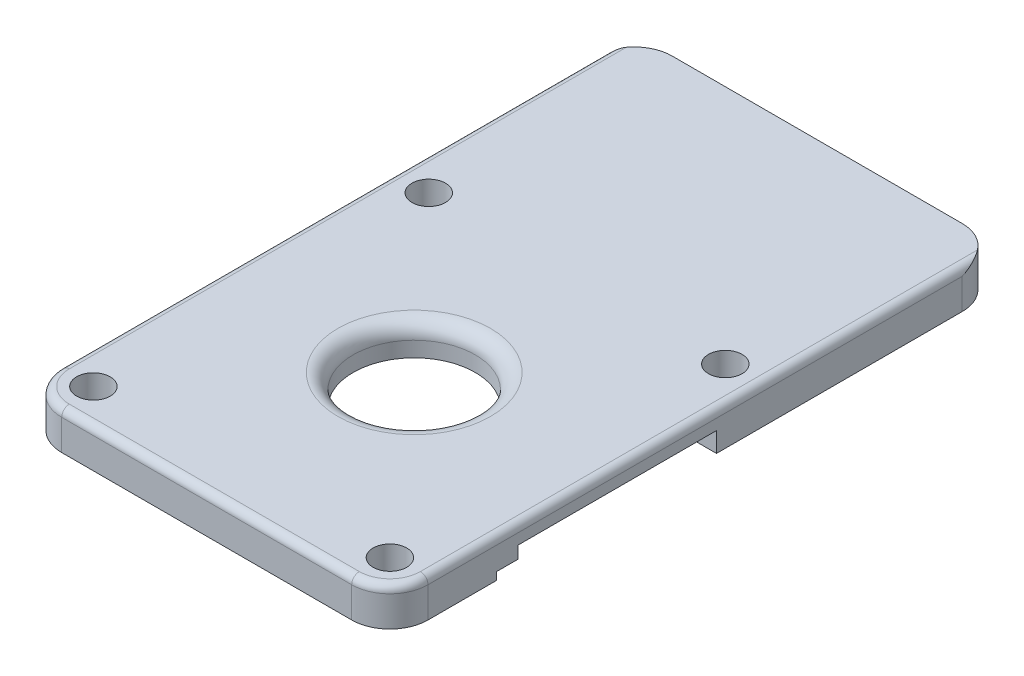
from build123d import *

# Parameters (mm, degrees)
SKETCH_1_R           = 1.1
SKETCH_1_R_2         = 4
EXTRUDE_1_DEPTH      = 2.5
SKETCH_2_W           = 14.4
SKETCH_2_H           = 0.5
CUT_EXTRUDE_1_DEPTH  = 37.005863078
SKETCH_3_W           = 13
SKETCH_3_H           = 1.3
CUT_EXTRUDE_2_DEPTH  = 4.5
SKETCH_4_W           = 13
SKETCH_4_H           = 1.3
CUT_EXTRUDE_3_DEPTH  = 4.5
SKETCH_5_W           = 11.5
SKETCH_5_H           = 17.3
CUT_EXTRUDE_11_DEPTH = 0.5
SKETCH_6_W           = 6
SKETCH_6_H           = 10
CUT_EXTRUDE_12_DEPTH = 0.5
FILLET_1_R           = 0.5
FILLET_2_R           = 1


with BuildPart() as part:
    # 草图1 → 凸台-拉伸1 (new body)
    with BuildSketch(Plane(origin=(0, 0, 0), x_dir=(1, 0, 0), z_dir=(0, 1, 0))):
        with BuildLine():
            Line((-12, 24.224), (-12, -10.776))
            ThreePointArc((-12, -10.776), (-11.267766953, -12.543766953), (-9.5, -13.276))
            Line((-9.5, -13.276), (9.5, -13.276))
            ThreePointArc((9.5, -13.276), (11.267766953, -12.543766953), (12, -10.776))
            Line((12, -10.776), (12, 24.224))
            ThreePointArc((12, 24.224), (11.267766953, 25.991766953), (9.5, 26.724))
            Line((9.5, 26.724), (-9.5, 26.724))
            ThreePointArc((-9.5, 26.724), (-11.267766953, 25.991766953), (-12, 24.224))
        make_face()
        with Locations(Location((-9.714, -10.986, 0), (0, 0, 270))):
            Circle(SKETCH_1_R, mode=Mode.SUBTRACT)
        with Locations(Location((0, 0.32, 0), (0, 0, 270))):
            Circle(SKETCH_1_R_2, mode=Mode.SUBTRACT)
        with Locations(Location((9.714, -10.986, 0), (0, 0, 270))):
            Circle(SKETCH_1_R, mode=Mode.SUBTRACT)
        with Locations(Location((9.714, 10.986, 0), (0, 0, 270))):
            Circle(SKETCH_1_R, mode=Mode.SUBTRACT)
        with Locations(Location((-9.714, 10.986, 0), (0, 0, 270))):
            Circle(SKETCH_1_R, mode=Mode.SUBTRACT)
    extrude(amount=-EXTRUDE_1_DEPTH)

    # 草图2 → 切除-拉伸1 (cut, through all)
    with BuildSketch(Plane(origin=(12, 0, 0), x_dir=(0, 0, -1), z_dir=(1, 0, 0))):
        with Locations((0.924, -2.25)):
            Rectangle(SKETCH_2_W, SKETCH_2_H)
    extrude(amount=-CUT_EXTRUDE_1_DEPTH, mode=Mode.SUBTRACT)

    # 草图3 → 切除-拉伸2 (cut)
    with BuildSketch(Plane(origin=(12, 0, 0), x_dir=(0, 0, -1), z_dir=(1, 0, 0))):
        with Locations((1.624, -1.85)):
            Rectangle(SKETCH_3_W, SKETCH_3_H)
    extrude(amount=-CUT_EXTRUDE_2_DEPTH, mode=Mode.SUBTRACT)

    # 草图4 → 切除-拉伸3 (cut)
    with BuildSketch(Plane.ZY.offset(12)):
        with Locations((-1.624, -1.85)):
            Rectangle(SKETCH_4_W, SKETCH_4_H)
    extrude(amount=-CUT_EXTRUDE_3_DEPTH, mode=Mode.SUBTRACT)

    # 草图5 → 切除-拉伸11 (cut)
    with BuildSketch(Plane.XZ.offset(2.5)):
        with Locations((1.75, -16.774)):
            Rectangle(SKETCH_5_W, SKETCH_5_H)
    extrude(amount=-CUT_EXTRUDE_11_DEPTH, mode=Mode.SUBTRACT)

    # 草图6 → 切除-拉伸12 (cut)
    with BuildSketch(Plane.XZ.offset(2)):
        with Locations((-1, -13.124)):
            Rectangle(SKETCH_6_W, SKETCH_6_H)
    extrude(amount=-CUT_EXTRUDE_12_DEPTH, mode=Mode.SUBTRACT)

    # 圆角1
    # the kernel refuses this fillet: 0.5 mm, written as the material it takes off along each edge
    with BuildSketch(Plane(origin=(-9.5, 0, 13.276), x_dir=(0, 0, -1), z_dir=(1, 0, 0))) as fillet_1_piece_1:
        with BuildLine():
            CenterArc((FILLET_1_R, -FILLET_1_R), FILLET_1_R, 90, 90)
            Line((0, -FILLET_1_R), (-FILLET_1_R * 0.02, -FILLET_1_R))
            Line((-FILLET_1_R * 0.02, -FILLET_1_R), (-FILLET_1_R * 0.02, FILLET_1_R * 0.02))
            Line((-FILLET_1_R * 0.02, FILLET_1_R * 0.02), (FILLET_1_R, FILLET_1_R * 0.02))
            Line((FILLET_1_R, FILLET_1_R * 0.02), (FILLET_1_R, 0))
        make_face()
    extrude(amount=19, mode=Mode.SUBTRACT)
    with BuildSketch(Plane(origin=(-9.5, 0, 10.776), x_dir=(-1, 0, 0), z_dir=(0, 0, -1))) as fillet_1_piece_2:
        with BuildLine():
            CenterArc((2.5 - FILLET_1_R, -FILLET_1_R), FILLET_1_R, 0, 90)
            Line((2.5, -FILLET_1_R), (2.5 + FILLET_1_R * 0.02, -FILLET_1_R))
            Line((2.5 + FILLET_1_R * 0.02, -FILLET_1_R), (2.5 + FILLET_1_R * 0.02, FILLET_1_R * 0.02))
            Line((2.5 + FILLET_1_R * 0.02, FILLET_1_R * 0.02), (2.5 - FILLET_1_R, FILLET_1_R * 0.02))
            Line((2.5 - FILLET_1_R, FILLET_1_R * 0.02), (2.5 - FILLET_1_R, 0))
        make_face()
    revolve(axis=Axis((-9.5, 0, 10.776), (0, 1, 0)), revolution_arc=90, mode=Mode.SUBTRACT)
    with BuildSketch(Plane(origin=(-12, 0, -27.224), x_dir=(0, -1, 0), z_dir=(0, 0, 1))) as fillet_1_piece_3:
        with BuildLine():
            CenterArc((FILLET_1_R, FILLET_1_R), FILLET_1_R, 180, 90)
            Line((0, FILLET_1_R), (-FILLET_1_R * 0.02, FILLET_1_R))
            Line((-FILLET_1_R * 0.02, FILLET_1_R), (-FILLET_1_R * 0.02, -FILLET_1_R * 0.02))
            Line((-FILLET_1_R * 0.02, -FILLET_1_R * 0.02), (FILLET_1_R, -FILLET_1_R * 0.02))
            Line((FILLET_1_R, -FILLET_1_R * 0.02), (FILLET_1_R, 0))
        make_face()
    extrude(amount=38, mode=Mode.SUBTRACT)
    with BuildSketch(Plane(origin=(12, 0, 10.776), x_dir=(-1, 0, 0), z_dir=(0, 0, -1))) as fillet_1_piece_4:
        with BuildLine():
            CenterArc((FILLET_1_R, -FILLET_1_R), FILLET_1_R, 90, 90)
            Line((0, -FILLET_1_R), (-FILLET_1_R * 0.02, -FILLET_1_R))
            Line((-FILLET_1_R * 0.02, -FILLET_1_R), (-FILLET_1_R * 0.02, FILLET_1_R * 0.02))
            Line((-FILLET_1_R * 0.02, FILLET_1_R * 0.02), (FILLET_1_R, FILLET_1_R * 0.02))
            Line((FILLET_1_R, FILLET_1_R * 0.02), (FILLET_1_R, 0))
        make_face()
    extrude(amount=38, mode=Mode.SUBTRACT)
    with BuildSketch(Plane(origin=(9.5, 0, 10.776), x_dir=(0, 0, 1), z_dir=(-1, 0, 0))) as fillet_1_piece_5:
        with BuildLine():
            CenterArc((2.5 - FILLET_1_R, -FILLET_1_R), FILLET_1_R, 0, 90)
            Line((2.5, -FILLET_1_R), (2.5 + FILLET_1_R * 0.02, -FILLET_1_R))
            Line((2.5 + FILLET_1_R * 0.02, -FILLET_1_R), (2.5 + FILLET_1_R * 0.02, FILLET_1_R * 0.02))
            Line((2.5 + FILLET_1_R * 0.02, FILLET_1_R * 0.02), (2.5 - FILLET_1_R, FILLET_1_R * 0.02))
            Line((2.5 - FILLET_1_R, FILLET_1_R * 0.02), (2.5 - FILLET_1_R, 0))
        make_face()
    revolve(axis=Axis((9.5, 0, 10.776), (0, 1, 0)), revolution_arc=90, mode=Mode.SUBTRACT)

    # 圆角2
    fillet_2_edges = [part.edges().sort_by_distance(p)[0] for p in [
        (0, 0, -4.32),
    ]]
    fillet(fillet_2_edges, radius=FILLET_2_R)


solid = part.part
